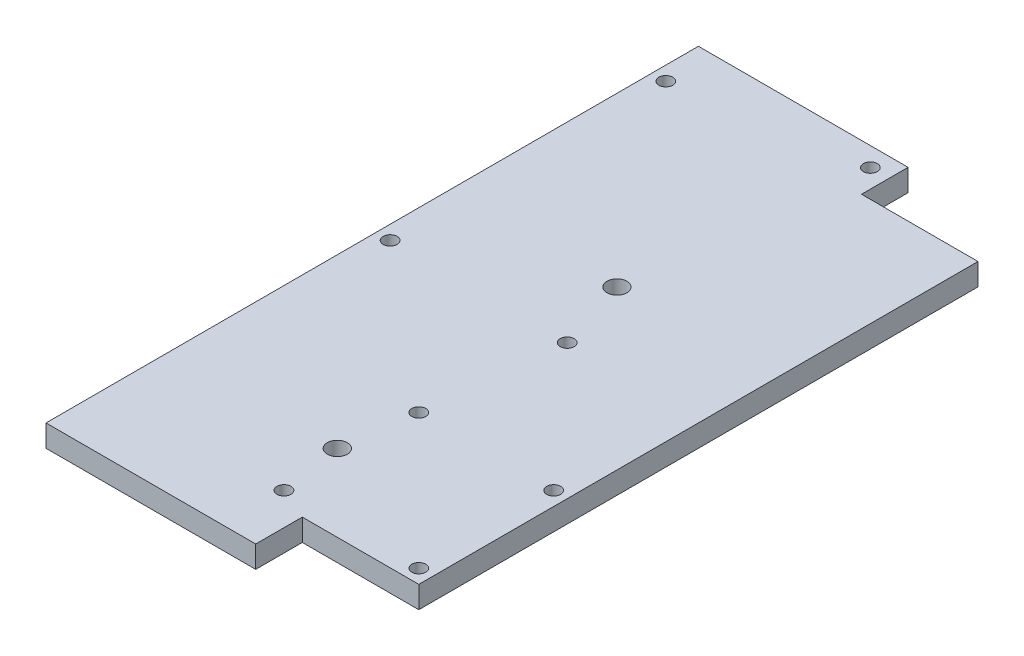
from build123d import *

# Parameters (mm, degrees)
BOSS_EXTRUDE1_DEPTH     = 5.9944
CUT_EXTRUDE1_DEPTH      = 199.87680315
CUT_EXTRUDE1_DEPTH_BACK = 199.87680315
SKETCH3_R               = 1.905
CUT_EXTRUDE2_DEPTH      = 199.87680315
CUT_EXTRUDE2_DEPTH_BACK = 199.87680315
SKETCH4_R               = 2.7305


with BuildPart() as part:
    # Sketch2 → Boss-Extrude1 (new body)
    with BuildSketch(Plane(origin=(0, 0, 0), x_dir=(1, 0, 0), z_dir=(0, 1, 0))):
        Polygon((0, 0), (57.15, 0), (57.15, 12.7), (88.9, 12.7), (88.9, 165.1), (57.15, 165.1), (57.15, 177.8), (0, 177.8), align=None)
    extrude(amount=BOSS_EXTRUDE1_DEPTH)

    # Sketch3 → Cut-Extrude1 (cut, two sides: drawn at the far end of the back side and taken through both)
    with BuildSketch(Plane(origin=(0, 5.9944, 0), x_dir=(1, 0, 0), z_dir=(0, 1, 0)).offset(-CUT_EXTRUDE1_DEPTH_BACK)):
        with Locations((52.07, 172.593)):
            Circle(SKETCH3_R)
        with Locations((3.81, 165.1)):
            Circle(SKETCH3_R)
        with Locations((3.81, 89.9668)):
            Circle(SKETCH3_R)
        with Locations((52.07, 89.9668)):
            Circle(SKETCH3_R)
        with Locations((48.3362, 53.2638)):
            Circle(SKETCH3_R)
        with Locations((85.09, 53.2638)):
            Circle(SKETCH3_R)
        with Locations((48.3362, 16.51)):
            Circle(SKETCH3_R)
        with Locations((85.09, 16.51)):
            Circle(SKETCH3_R)
    extrude(amount=CUT_EXTRUDE1_DEPTH + CUT_EXTRUDE1_DEPTH_BACK, mode=Mode.SUBTRACT)

    # Sketch4 → Cut-Extrude2 (cut, two sides: drawn at the far end of the back side and taken through both)
    with BuildSketch(Plane(origin=(0, 5.9944, 0), x_dir=(1, 0, 0), z_dir=(0, 1, 0)).offset(-CUT_EXTRUDE2_DEPTH_BACK)):
        with Locations((45.72, 109.871331367)):
            Circle(SKETCH4_R)
        with Locations((45.72, 33.671331367)):
            Circle(SKETCH4_R)
    extrude(amount=CUT_EXTRUDE2_DEPTH + CUT_EXTRUDE2_DEPTH_BACK, mode=Mode.SUBTRACT)


solid = part.part
